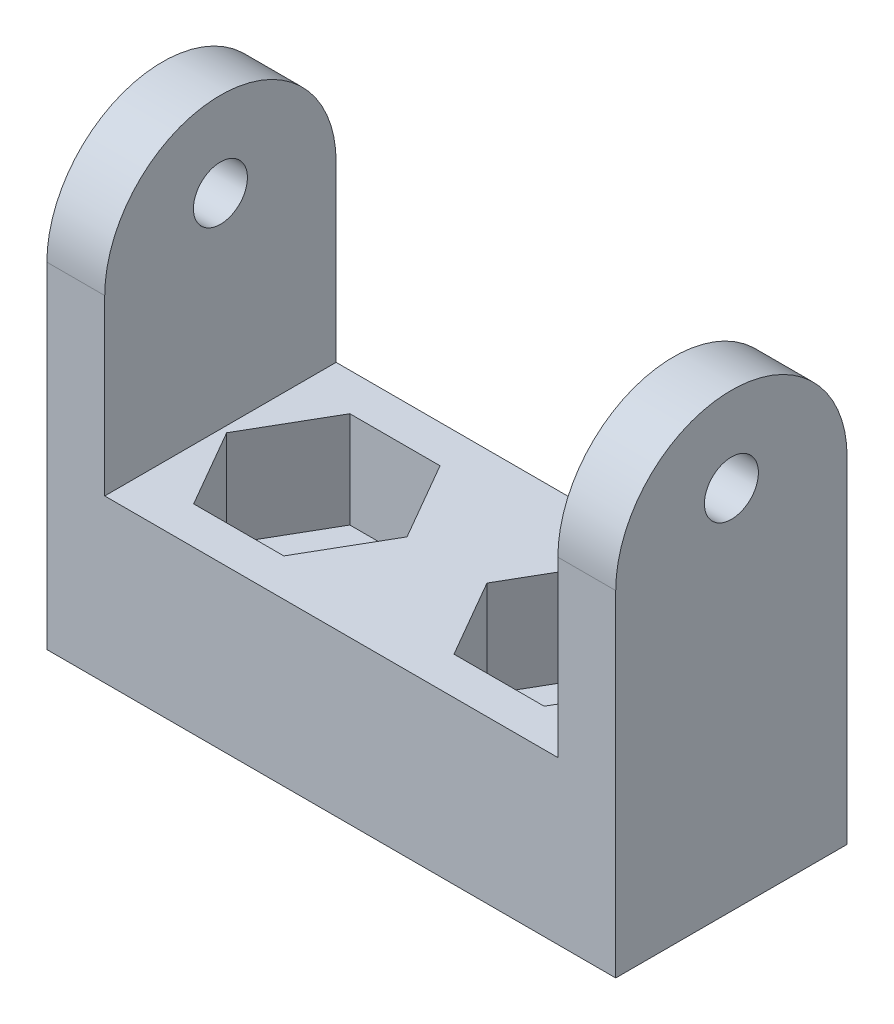
from build123d import *

# Parameters (mm, degrees)
SKETCH_1_W          = 29.5
SKETCH_1_H          = 12
EXTRUDE_1_DEPTH     = 23.4
SKETCH_3_W          = 23.5
SKETCH_3_H          = 12
CUT_EXTRUDE_1_DEPTH = 15
SKETCH_4_R          = 1.4
CUT_EXTRUDE_2_DEPTH = 39.12886046
FILLET_1_RADIUS     = 6
FILLET_1_LENGTH     = 3
MIRROR_START        = 11.75
MIRROR_1_DEPTH      = 3
HOLE_WIZARD_M5_1_D  = 5.3
CUT_EXTRUDE_4_DEPTH = 5


# Read off the part's stored shape, not the designer's step: 镜向1
with BuildPart() as part:
    # 草图1 → 凸台-拉伸1 (new body)
    with BuildSketch(Plane(origin=(0, 0, 0), x_dir=(1, 0, 0), z_dir=(0, 1, 0))):
        Rectangle(SKETCH_1_W, SKETCH_1_H)
    extrude(amount=EXTRUDE_1_DEPTH)

    # 草图3 → 切除-拉伸1 (cut)
    with BuildSketch(Plane(origin=(0, 23.4, 0), x_dir=(1, 0, 0), z_dir=(0, 1, 0))):
        Rectangle(SKETCH_3_W, SKETCH_3_H)
    extrude(amount=-CUT_EXTRUDE_1_DEPTH, mode=Mode.SUBTRACT)

    # 草图4 → 切除-拉伸2 (cut, through all)
    with BuildSketch(Plane.ZY.offset(14.75)):
        with Locations((0, 19)):
            Circle(SKETCH_4_R)
    extrude(amount=-CUT_EXTRUDE_2_DEPTH, mode=Mode.SUBTRACT)

    # 圆角1: full round fillet: the end face becomes a half cylinder, R = half its width
    fillet_1_face = Plane((-13.25, 23.4, 0), x_dir=(-1, 0, 0), z_dir=(0, 1, 0))  # on the end face: x along it, z out of the body
    fillet_1_slab = fillet_1_face.offset(-FILLET_1_RADIUS / 2) * Box(FILLET_1_LENGTH, 2 * FILLET_1_RADIUS, FILLET_1_RADIUS, mode=Mode.PRIVATE)  # the body's end, R deep
    fillet_1_round = Plane((-13.25, 17.4, 0), x_dir=(0, 1, 0), z_dir=(-1, 0, 0)) * Cylinder(FILLET_1_RADIUS, FILLET_1_LENGTH, mode=Mode.PRIVATE)  # its axis R under the face
    add(fillet_1_slab - fillet_1_round, mode=Mode.SUBTRACT)

    # 镜向1 outline → 镜向1 (cut)
    with BuildSketch(Plane.YZ.offset(MIRROR_START)):
        with BuildLine():
            Line((23.4, 6), (17.4, 6))
            ThreePointArc((17.4, 6), (21.642640687, 4.242640687), (23.4, 0))
            Line((23.4, 0), (23.4, 6))
        make_face()
        with BuildLine():
            Line((23.4, -6), (23.4, 0))
            ThreePointArc((23.4, 0), (21.642640687, -4.242640687), (17.4, -6))
            Line((17.4, -6), (23.4, -6))
        make_face()
    extrude(amount=MIRROR_1_DEPTH, mode=Mode.SUBTRACT)

    # M5 间隙孔1 (through all)
    with Locations(Plane(origin=(0, 0, 0), x_dir=(-1, 0, 0), z_dir=(0, -1, 0))):
        with Locations((-6.75, 0), (6.75, 0)):
            Hole(HOLE_WIZARD_M5_1_D / 2)

    # 草图10 → 切除-拉伸4 (cut)
    with BuildSketch(Plane.XZ.offset(-8.4)):
        Polygon((2.07346282, 0), (4.41173141, -4.05), (9.08826859, -4.05), (11.42653718, 0), (9.08826859, 4.05), (4.41173141, 4.05), align=None)
        Polygon((-11.42653718, 0), (-9.08826859, -4.05), (-4.41173141, -4.05), (-2.07346282, 0), (-4.41173141, 4.05), (-9.08826859, 4.05), align=None)
    extrude(amount=CUT_EXTRUDE_4_DEPTH, mode=Mode.SUBTRACT)


solid = part.part
